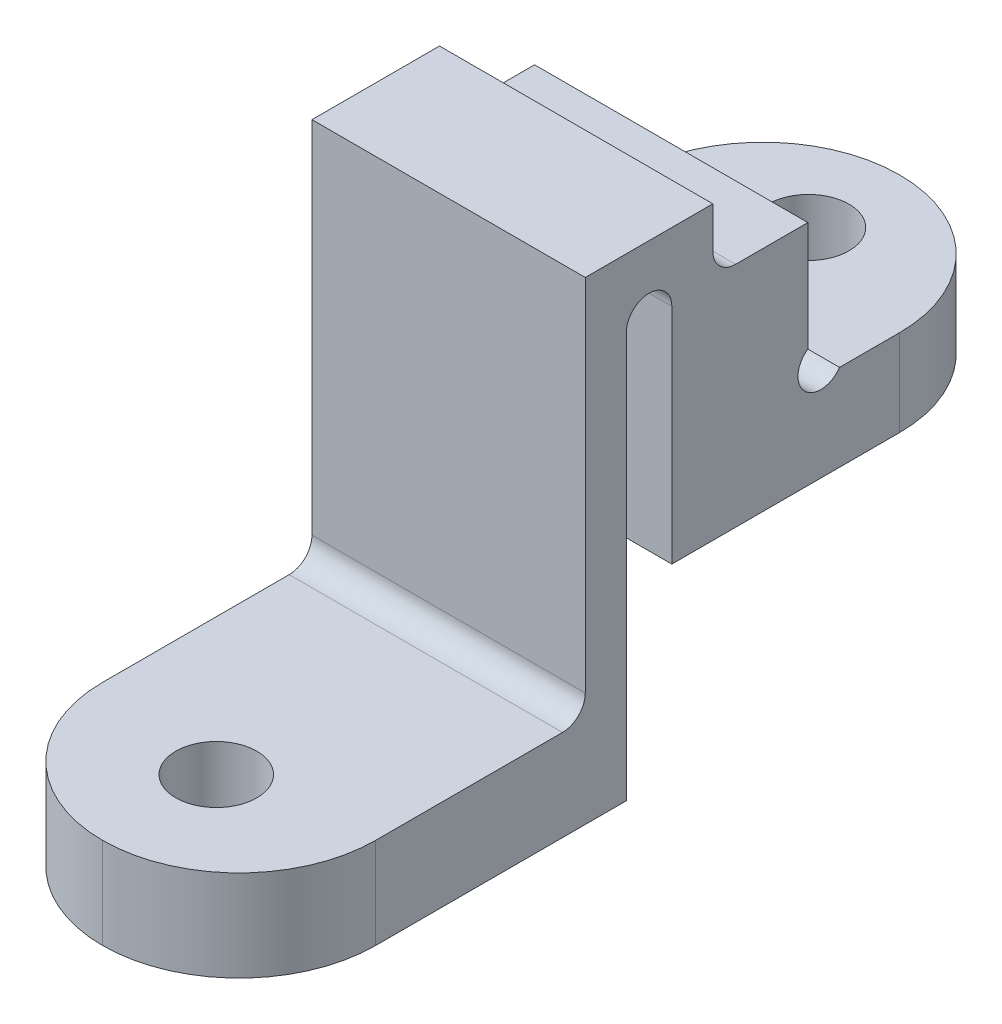
from build123d import *

# Parameters (mm, degrees)
BOSS_EXTRUDE1_DEPTH   = 6
SKETCH3_W             = 7.6
SKETCH3_H             = 8.4
SKETCH3_H_2           = 4.9
CUT_EXTRUDE2_DEPTH    = 21.860671783
SKETCH4_W             = 7.6
SKETCH4_H             = 3.5
SKETCH4_W_2           = 5.5
SKETCH4_H_2           = 3.1
CUT_EXTRUDE3_DEPTH    = 21.860671783
FILLET2_R             = 3
F_2_56_TAPPED_HOLE1_D = 1.778
FILLET3_R             = 0.5
F_2_56_TAPPED_HOLE2_D = 1.778
SKETCH19_R            = 0.5
CUT_EXTRUDE6_DEPTH    = 21.860671783


with BuildPart() as part:
    # Sketch1 → Boss-Extrude1 (new body)
    with BuildSketch(Plane(origin=(7.5, 0, 0), x_dir=(0, 0, -1), z_dir=(1, 0, 0))):
        with BuildLine():
            Line((-10.5, 16.997577099), (-10.5, 6.597577099))
            Line((-10.5, 6.597577099), (-2, 6.597577099))
            Line((-2, 6.597577099), (-2, 15.497577099))
            ThreePointArc((-2, 15.497577099), (-1.5, 15.997577099), (-1, 15.497577099))
            Line((-1, 15.497577099), (-1, 10.597577099))
            Line((-1, 10.597577099), (7, 10.597577099))
            Line((7, 10.597577099), (7, 16.997577099))
            Line((7, 16.997577099), (-10.5, 16.997577099))
        make_face()
    extrude(amount=-BOSS_EXTRUDE1_DEPTH)

    # Sketch3 → Cut-Extrude2 (cut, through all)
    with BuildSketch(Plane.ZY.offset(-1.5)):
        with Locations((6.7, 16.297577099)):
            Rectangle(SKETCH3_W, SKETCH3_H)
        with Locations((-3.7, 18.047577099)):
            Rectangle(SKETCH3_W, SKETCH3_H_2)
    extrude(amount=-CUT_EXTRUDE2_DEPTH, mode=Mode.SUBTRACT)

    # Sketch4 → Cut-Extrude3 (cut, through all)
    with BuildSketch(Plane.ZY.offset(-1.5)):
        with Locations((6.7, 10.347577099)):
            Rectangle(SKETCH4_W, SKETCH4_H)
        with Locations((-4.736302331, 14.047577099)):
            Rectangle(SKETCH4_W_2, SKETCH4_H_2)
    extrude(amount=-CUT_EXTRUDE3_DEPTH, mode=Mode.SUBTRACT)

    # Fillet2
    fillet2_edges = [part.edges().sort_by_distance(p)[0] for p in [
        (1.5, 7.597577099, 10.5),
        (7.5, 7.597577099, 10.5),
        (7.5, 11.547577099, -7),
        (1.5, 11.547577099, -7),
    ]]
    fillet(fillet2_edges, radius=FILLET2_R - 0.0001)  # a hair under: the kernel refuses the full size

    # #2-56 Tapped Hole1 (through all)
    with Locations(Plane(origin=(0, 8.597577099, 0), x_dir=(1, 0, 0), z_dir=(0, 1, 0))):
        with Locations((4.5, -8)):
            Hole(F_2_56_TAPPED_HOLE1_D / 2)

    # Fillet3
    fillet3_edges = [part.edges().sort_by_distance(p)[0] for p in [
        (4.5, 15.597577099, 0.1),
        (4.5, 8.597577099, 2.9),
    ]]
    fillet(fillet3_edges, radius=FILLET3_R)

    # #2-56 Tapped Hole2 (through all)
    with Locations(Plane(origin=(0, 12.497577099, 0), x_dir=(1, 0, 0), z_dir=(0, 1, 0))):
        with Locations((4.5, 5)):
            Hole(F_2_56_TAPPED_HOLE2_D / 2)

    # Sketch19 → Cut-Extrude6 (cut, through all)
    with BuildSketch(Plane(origin=(7.5, 0, 0), x_dir=(0, 0, -1), z_dir=(1, 0, 0))):
        with Locations((2.269145043, 12.780419811)):
            Circle(SKETCH19_R)
    extrude(amount=-CUT_EXTRUDE6_DEPTH, mode=Mode.SUBTRACT)


solid = part.part
